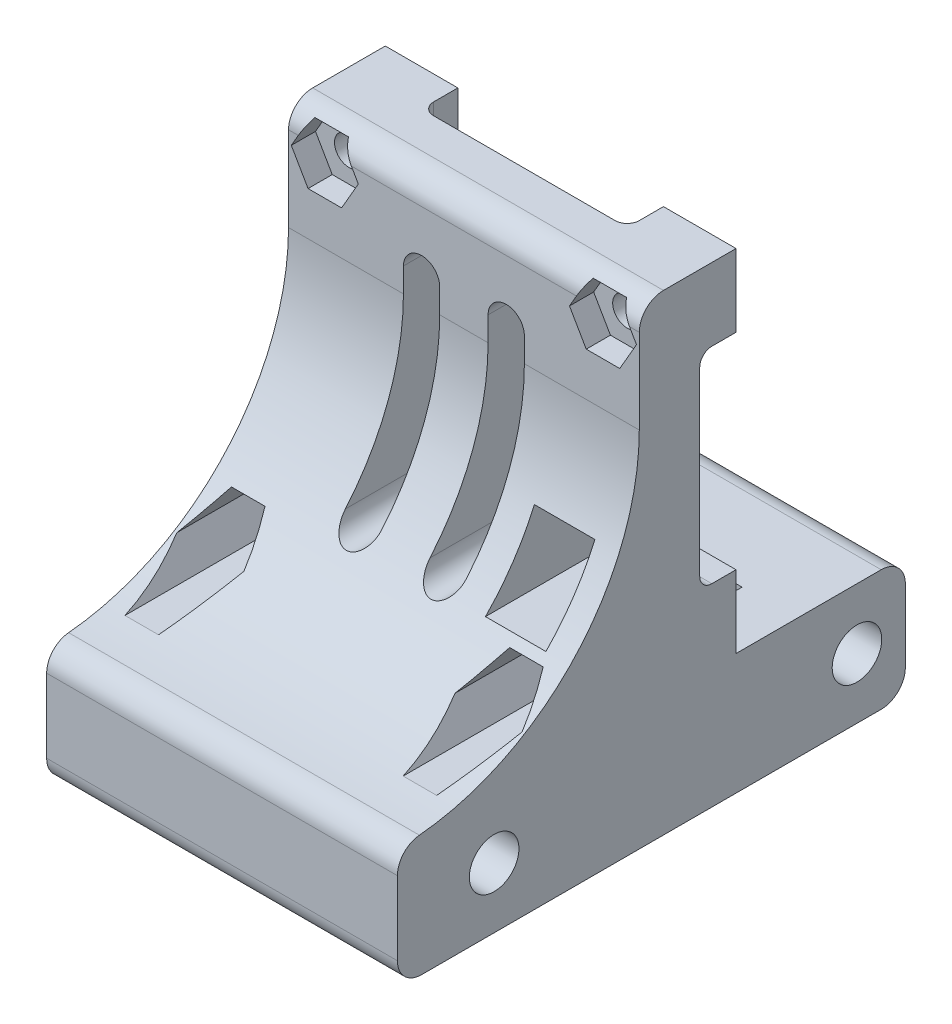
from build123d import *
from build123d.topology import SkipClean

# Parameters (mm, degrees)
SKETCH3_W               = 29
SKETCH3_H               = 29
SKETCH3_R               = 1.2
SKETCH3_W_2             = 5
SKETCH3_H_2             = 6
BOSS_EXTRUDE1_DEPTH     = 5
SKETCH4_W               = 29
SKETCH4_H               = 42
SKETCH4_W_2             = 20
SKETCH4_H_2             = 11
BOSS_EXTRUDE2_DEPTH     = 10
BOSS_EXTRUDE3_START     = 3
SKETCH5_W               = 6
SKETCH5_H               = 6
SKETCH5_R               = 1.2
BOSS_EXTRUDE3_DEPTH     = 3
FILLET1_DEPTH           = 22
FILLET1_START           = 19.5
FILLET1_2_DEPTH         = 9.5
FILLET1_3_DEPTH         = 9.5
FILLET1_START_2         = 27
FILLET1_4_DEPTH         = 2
FILLET1_START_3         = 12.5
FILLET1_5_DEPTH         = 4
FILLET1_START_4         = 5
FILLET1_6_OUTLINE_R     = 1.2
FILLET1_6_DEPTH         = 20
CUT_EXTRUDE1_DEPTH      = 47.540305175
CUT_EXTRUDE1_DEPTH_BACK = 2
FILLET2_R               = 1
SKETCH7_R               = 2.05
CUT_EXTRUDE2_DEPTH      = 49.031239886
FILLET3_R               = 2


with BuildPart() as part:
    # Sketch3 → Boss-Extrude1 (new body)
    with BuildSketch(Plane.XY):
        with Locations((14.5, 14.5)):
            Rectangle(SKETCH3_W, SKETCH3_H)
        with Locations((3, 26)):
            Circle(SKETCH3_R, mode=Mode.SUBTRACT)
        with Locations(Location((26, 26, 0), (0, 0, 180))):
            Circle(SKETCH3_R, mode=Mode.SUBTRACT)
        with Locations((26, 3)):
            Circle(SKETCH3_R, mode=Mode.SUBTRACT)
        with Locations(Location((3, 3, 0), (0, 0, 180))):
            Circle(SKETCH3_R, mode=Mode.SUBTRACT)
        with Locations((24.5, 9)):
            Rectangle(SKETCH3_W_2, SKETCH3_H_2, mode=Mode.SUBTRACT)
        with BuildLine():
            Line((16.5, 7), (16.5, 22))
            ThreePointArc((16.5, 22), (18, 23.5), (19.5, 22))
            Line((19.5, 22), (19.5, 7))
            ThreePointArc((19.5, 7), (18, 5.5), (16.5, 7))
        make_face(mode=Mode.SUBTRACT)
        with BuildLine():
            Line((12.5, 7), (12.5, 22))
            ThreePointArc((12.5, 22), (11, 23.5), (9.5, 22))
            Line((9.5, 22), (9.5, 7))
            ThreePointArc((9.5, 7), (11, 5.5), (12.5, 7))
        make_face(mode=Mode.SUBTRACT)
    extrude(amount=BOSS_EXTRUDE1_DEPTH)

    # Sketch4 → Boss-Extrude2 (add)
    with BuildSketch(Plane(origin=(0, 0, 0), x_dir=(1, 0, 0), z_dir=(0, 1, 0))):
        with Locations((14.5, -4)):
            Rectangle(SKETCH4_W, SKETCH4_H)
        with Locations((14.5, 2.5)):
            Rectangle(SKETCH4_W_2, SKETCH4_H_2, mode=Mode.SUBTRACT)
    extrude(amount=-BOSS_EXTRUDE2_DEPTH)

    # Sketch5 → Boss-Extrude3 (add)
    # profile 1 of 4: a face of its own
    with BuildSketch(Plane(origin=(0, 0, 0), x_dir=(-1, 0, 0), z_dir=(0, 0, -1)).offset(BOSS_EXTRUDE3_START)):
        with Locations((-26, 3)):
            Rectangle(SKETCH5_W, SKETCH5_H)
        with Locations((-26, 3)):
            Circle(SKETCH5_R, mode=Mode.SUBTRACT)
    # profile 2 of 4: a face of its own
    with BuildSketch(Plane(origin=(0, 0, 0), x_dir=(-1, 0, 0), z_dir=(0, 0, -1)).offset(BOSS_EXTRUDE3_START)):
        with Locations((-26, 26)):
            Rectangle(SKETCH5_W, SKETCH5_H)
        with Locations((-26, 26)):
            Circle(SKETCH5_R, mode=Mode.SUBTRACT)
    # profile 3 of 4: a face of its own
    with BuildSketch(Plane(origin=(0, 0, 0), x_dir=(-1, 0, 0), z_dir=(0, 0, -1)).offset(BOSS_EXTRUDE3_START)):
        with Locations((-3, 3)):
            Rectangle(SKETCH5_W, SKETCH5_H)
        with Locations((-3, 3)):
            Circle(SKETCH5_R, mode=Mode.SUBTRACT)
    # profile 4 of 4: a face of its own
    with BuildSketch(Plane(origin=(0, 0, 0), x_dir=(-1, 0, 0), z_dir=(0, 0, -1)).offset(BOSS_EXTRUDE3_START)):
        with Locations((-3, 26)):
            Rectangle(SKETCH5_W, SKETCH5_H)
        with Locations((-3, 26)):
            Circle(SKETCH5_R, mode=Mode.SUBTRACT)
    extrude(amount=-BOSS_EXTRUDE3_DEPTH)

    # Fillet1: read off the stored shape, not the designer's step
    # Fillet1 outline → Fillet1 (add)
    with BuildSketch(Plane.YZ):
        with BuildLine():
            Line((12, 5), (12, 6.66969722))
            ThreePointArc((12, 6.66969722), (3.266799469, 14.04554885), (0, 25))
            Line((0, 25), (0, 5))
            Line((0, 5), (12, 5))
        make_face()
    extrude(amount=FILLET1_DEPTH)

    # Fillet1 2 outline → Fillet1 2 (add)
    with SkipClean():  # the faces are left unmerged after this step: merging them gives an invalid solid
        with BuildSketch(Plane.YZ.offset(FILLET1_START)):
            with BuildLine():
                ThreePointArc((20, 5), (15.913807126, 5.421873741), (12, 6.66969722))
                Line((12, 6.66969722), (12, 5))
                Line((12, 5), (20, 5))
            make_face()
            with BuildLine():
                Line((6, 5), (6, 10.717143143))
                ThreePointArc((6, 10.717143143), (1.560911085, 17.254033307), (0, 25))
                Line((0, 25), (0, 5))
                Line((0, 5), (6, 5))
            make_face()
        extrude(amount=FILLET1_2_DEPTH)
    add(part.part.scale(1), mode=Mode.REPLACE)  # the faces are merged on a copy

    # Fillet1 3 outline → Fillet1 3 (add)
    with BuildSketch(Plane.YZ):
        with BuildLine():
            ThreePointArc((20, 5), (15.913807126, 5.421873741), (12, 6.66969722))
            Line((12, 6.66969722), (12, 5))
            Line((12, 5), (20, 5))
        make_face()
    extrude(amount=FILLET1_3_DEPTH)

    # Fillet1 4 outline → Fillet1 4 (add)
    with BuildSketch(Plane.YZ.offset(FILLET1_START_2)):
        with BuildLine():
            Line((12, 5), (12, 6.66969722))
            ThreePointArc((12, 6.66969722), (8.815392066, 8.419754363), (6, 10.717143143))
            Line((6, 10.717143143), (6, 5))
            Line((6, 5), (12, 5))
        make_face()
    extrude(amount=FILLET1_4_DEPTH)

    # Fillet1 5 outline → Fillet1 5 (add)
    with SkipClean():  # the faces are left unmerged after this step: merging them gives an invalid solid
        with BuildSketch(Plane.YZ.offset(FILLET1_START_3)):
            with BuildLine():
                ThreePointArc((20, 5), (15.913807126, 5.421873741), (12, 6.66969722))
                Line((12, 6.66969722), (12, 5))
                Line((12, 5), (20, 5))
            make_face()
        extrude(amount=FILLET1_5_DEPTH)

    # Fillet1 6 outline → Fillet1 6 (cut)
    with BuildSketch(Plane.XY.offset(FILLET1_START_4)):
        with Locations((26, 3)):
            Circle(FILLET1_6_OUTLINE_R)
        with Locations((3, 3)):
            Circle(FILLET1_6_OUTLINE_R)
        with BuildLine():
            ThreePointArc((16.5, 7), (18, 5.5), (19.5, 7))
            Line((19.5, 7), (19.5, 12))
            Line((19.5, 12), (16.5, 12))
            Line((16.5, 12), (16.5, 7))
        make_face()
        with BuildLine():
            ThreePointArc((9.5, 7), (11, 5.5), (12.5, 7))
            Line((12.5, 7), (12.5, 12))
            Line((12.5, 12), (9.5, 12))
            Line((9.5, 12), (9.5, 7))
        make_face()
    extrude(amount=FILLET1_6_DEPTH, mode=Mode.SUBTRACT)

    # Sketch6 → Cut-Extrude1 (cut, two sides: drawn at the far end of the back side and taken through both)
    with BuildSketch(Plane.XY.offset(5).offset(-CUT_EXTRUDE1_DEPTH_BACK)):
        Polygon((4.385640646, 0.6), (5.771281292, 3), (4.385640646, 5.4), (1.614359354, 5.4), (0.228718708, 3), (1.614359354, 0.6), align=None)
        Polygon((24.614359354, 0.6), (27.385640646, 0.6), (28.771281292, 3), (27.385640646, 5.4), (24.614359354, 5.4), (23.228718708, 3), align=None)
        Polygon((4.385640646, 23.6), (5.771281292, 26), (4.385640646, 28.4), (1.614359354, 28.4), (0.228718708, 26), (1.614359354, 23.6), align=None)
        Polygon((27.385640646, 23.6), (28.771281292, 26), (27.385640646, 28.4), (24.614359354, 28.4), (23.228718708, 26), (24.614359354, 23.6), align=None)
    extrude(amount=CUT_EXTRUDE1_DEPTH + CUT_EXTRUDE1_DEPTH_BACK, mode=Mode.SUBTRACT)

    # Fillet2
    fillet2_edges = [part.edges().sort_by_distance(p)[0] for p in [
        (28, 6, 0),
        (26, 23, 0),
        (3, 23, 0),
        (3, 6, 0),
        (6, 3, 0),
        (6, 26, 0),
        (23, 26, 0),
        (23, 3, 0),
    ]]
    fillet(fillet2_edges, radius=FILLET2_R)

    # Sketch7 → Cut-Extrude2 (cut, through all)
    with BuildSketch(Plane.ZY):
        with Locations((-13, -5)):
            Circle(SKETCH7_R)
        with Locations((17, -5)):
            Circle(SKETCH7_R)
    extrude(amount=-CUT_EXTRUDE2_DEPTH, mode=Mode.SUBTRACT)

    # Fillet3
    # the kernel refuses this fillet: 2 mm, written as the material it takes off along each edge
    with BuildSketch(Plane(origin=(-5, -10, -17), x_dir=(0, 0, 1), z_dir=(1, 0, 0)), Plane(origin=(34, -10, 25), x_dir=(0, 0, -1), z_dir=(-1, 0, 0))) as fillet3_piece_1:
        with BuildLine():
            CenterArc((FILLET3_R, -FILLET3_R), FILLET3_R, 90, 90)
            Line((0, -FILLET3_R), (0, 0))
            Line((0, 0), (FILLET3_R, 0))
        make_face()
    extrude(amount=39, mode=Mode.SUBTRACT)
    with BuildSketch(Plane(origin=(-5, 0, -17), x_dir=(0, 0, 1), z_dir=(1, 0, 0)), Plane(origin=(34, 29, 5), x_dir=(0, 0, -1), z_dir=(-1, 0, 0))) as fillet3_piece_2:
        with BuildLine():
            CenterArc((FILLET3_R, FILLET3_R), FILLET3_R, 180, 90)
            Line((0, FILLET3_R), (0, 0))
            Line((0, 0), (FILLET3_R, 0))
        make_face()
    extrude(amount=39, mode=Mode.SUBTRACT)
    with BuildSketch(Plane(origin=(19.5, 0, 25), x_dir=(0, -1, 0), z_dir=(-1, 0, 0))) as fillet3_piece_3:
        with BuildLine():
            CenterArc((1.9089023, -2), FILLET3_R, 90, 84.784091431)
            ThreePointArc((-0.082816091, -1.818181818), (-0.02071475, -0.910033465), (0, 0))
            Line((0, 0), (1.9089023, 0))
        make_face()
    extrude(amount=24.272255751, mode=Mode.SUBTRACT)
    with BuildSketch(Plane(origin=(22, 0, 25), x_dir=(0, -1, 0), z_dir=(-1, 0, 0))) as fillet3_piece_4:
        with BuildLine():
            CenterArc((1.9089023, -2), FILLET3_R, 90, 84.784091431)
            ThreePointArc((-0.082816091, -1.818181818), (-0.02071475, -0.910033465), (0, 0))
            Line((0, 0), (1.9089023, 0))
        make_face()
    extrude(amount=2.5, mode=Mode.SUBTRACT)
    with BuildSketch(Plane(origin=(33.772255751, 0, 25), x_dir=(0, -1, 0), z_dir=(-1, 0, 0))) as fillet3_piece_5:
        with BuildLine():
            CenterArc((1.9089023, -2), FILLET3_R, 90, 84.784091436)
            ThreePointArc((-0.08281609, -1.818181818), (-0.02071475, -0.910033465), (0, 0))
            Line((0, 0), (1.9089023, 0))
        make_face()
    extrude(amount=11.772255751, mode=Mode.SUBTRACT)


solid = part.part
